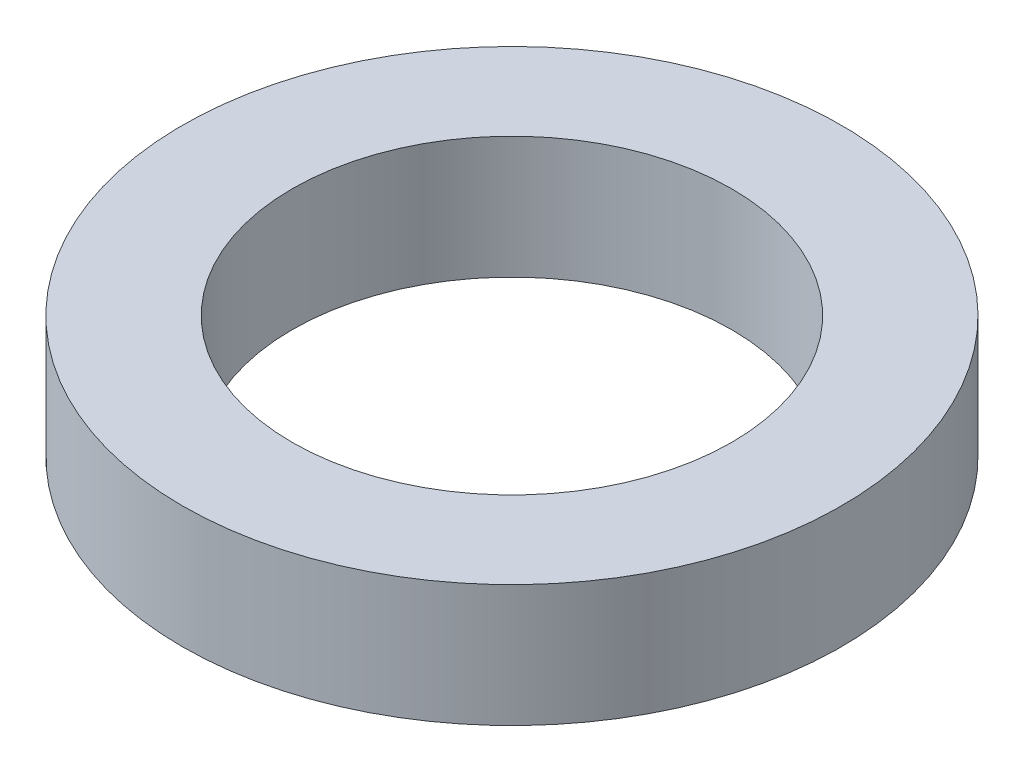
from build123d import *

# Parameters (mm, degrees)
SKETCH1_R           = 67.5
BOSS_EXTRUDE1_DEPTH = 25
SKETCH2_R           = 45
CUT_EXTRUDE1_DEPTH  = 99.67877178


with BuildPart() as part:
    # Sketch1 → Boss-Extrude1 (new body)
    with BuildSketch(Plane(origin=(0, 0, 0), x_dir=(1, 0, 0), z_dir=(0, 1, 0))):
        Circle(SKETCH1_R)
    extrude(amount=BOSS_EXTRUDE1_DEPTH)

    # Sketch2 → Cut-Extrude1 (cut, through all)
    with BuildSketch(Plane(origin=(0, 0, 0), x_dir=(1, 0, 0), z_dir=(0, 1, 0))):
        Circle(SKETCH2_R)
    extrude(amount=CUT_EXTRUDE1_DEPTH, mode=Mode.SUBTRACT)


solid = part.part
